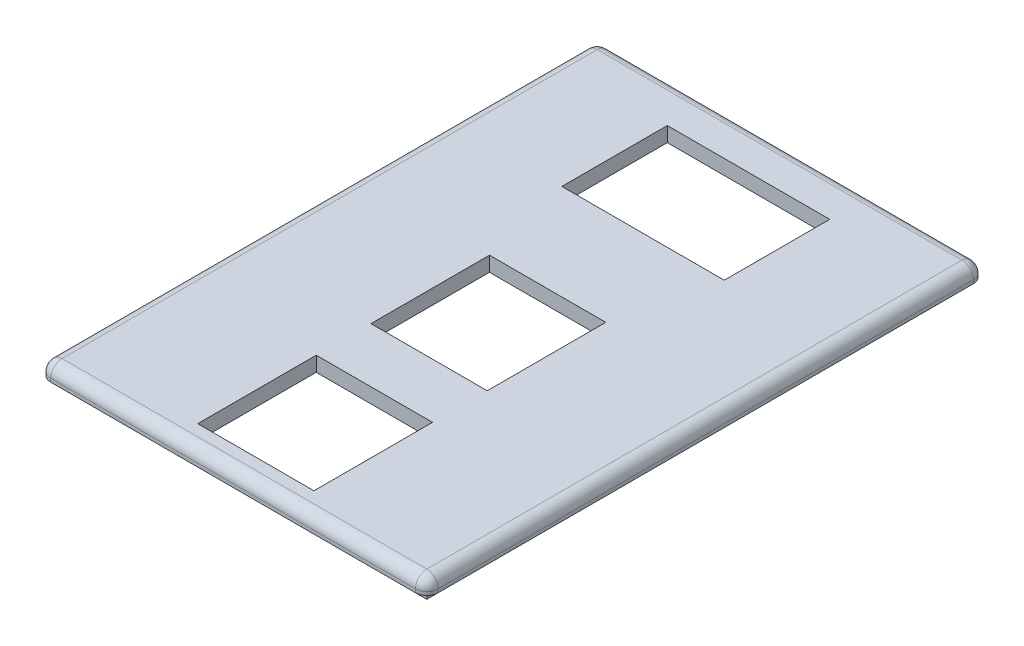
from build123d import *

# Parameters (mm, degrees)
SKETCH1_W           = 86.36
SKETCH1_H           = 124.333
BOSS_EXTRUDE1_DEPTH = 3.302
SKETCH2_W           = 81.28
SKETCH2_H           = 119.253
BOSS_EXTRUDE2_DEPTH = 2.54
CUT_EXTRUDE1_DEPTH  = 2.54
SKETCH6_W           = 25.908
SKETCH6_H           = 26.416
SKETCH6_W_2         = 36.195
SKETCH6_H_2         = 23.495
CUT_EXTRUDE2_DEPTH  = 3.302
FILLET1_R           = 2.54


with BuildPart() as part:
    # Sketch1 → Boss-Extrude1 (new body)
    with BuildSketch(Plane(origin=(0, 0, 0), x_dir=(1, 0, 0), z_dir=(0, 1, 0))):
        with Locations((43.18, 62.1665)):
            Rectangle(SKETCH1_W, SKETCH1_H)
    extrude(amount=BOSS_EXTRUDE1_DEPTH)

    # Sketch2 → Boss-Extrude2 (add)
    with BuildSketch(Plane.XZ):
        with Locations((43.18, -62.1665)):
            Rectangle(SKETCH2_W, SKETCH2_H)
    extrude(amount=BOSS_EXTRUDE2_DEPTH)

    # Sketch4 → Cut-Extrude1 (cut)
    with BuildSketch(Plane.XZ.offset(2.54)):
        Polygon((58.42, -121.793), (58.42, -119.253), (81.28, -119.253), (81.28, -5.08), (58.42, -5.08), (58.42, -2.54), (27.94, -2.54), (27.94, -5.08), (5.08, -5.08), (5.08, -119.253), (27.94, -119.253), (27.94, -121.793), align=None)
    extrude(amount=-CUT_EXTRUDE1_DEPTH, mode=Mode.SUBTRACT)

    # Sketch6 → Cut-Extrude2 (cut)
    with BuildSketch(Plane(origin=(0, 3.302, 0), x_dir=(1, 0, 0), z_dir=(0, 1, 0))):
        with Locations((43.18, 18.288)):
            Rectangle(SKETCH6_W, SKETCH6_H)
        with Locations((43.18, 56.896)):
            Rectangle(SKETCH6_W, SKETCH6_H)
        with Locations((43.1165, 103.1875)):
            Rectangle(SKETCH6_W_2, SKETCH6_H_2)
    extrude(amount=-CUT_EXTRUDE2_DEPTH, mode=Mode.SUBTRACT)

    # Fillet1
    fillet1_edges = [part.edges().sort_by_distance(p)[0] for p in [
        (86.36, 3.302, -62.1665),
        (43.18, 3.302, 0),
        (43.18, 3.302, -124.333),
        (0, 3.302, -62.1665),
        (0, 1.651, -124.333),
        (0, 1.651, 0),
        (86.36, 1.651, 0),
        (86.36, 1.651, -124.333),
    ]]
    fillet(fillet1_edges, radius=FILLET1_R)


solid = part.part
